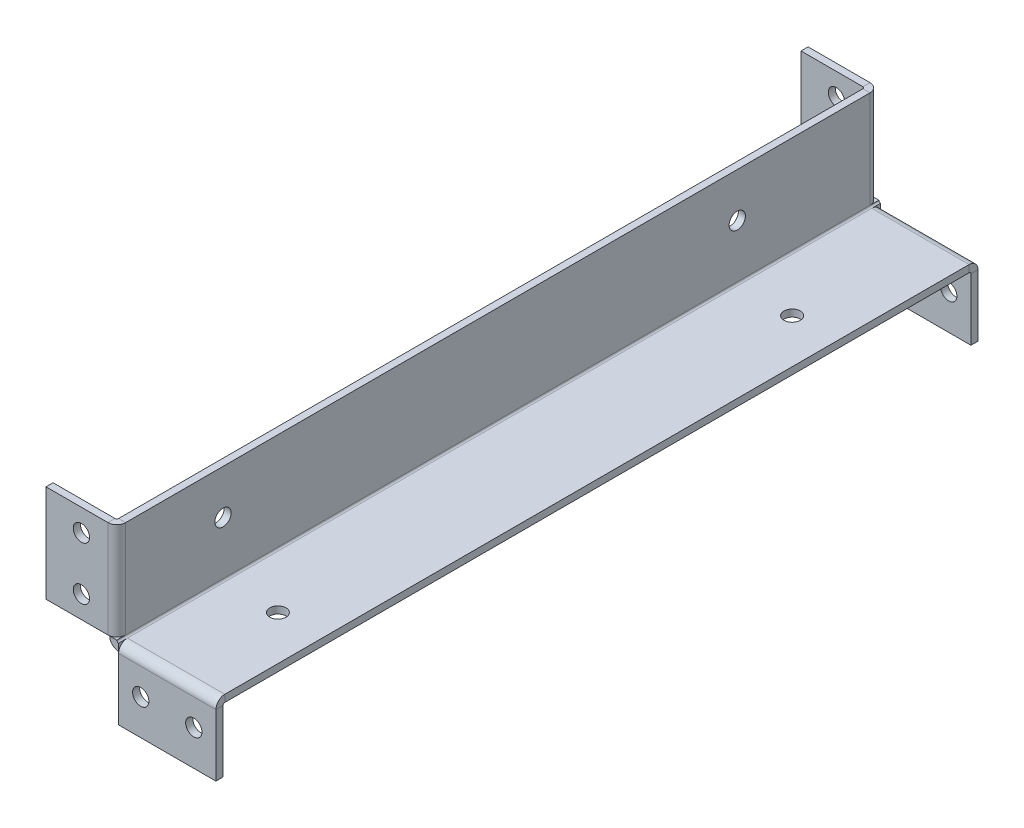
from build123d import *

# Parameters (mm, degrees)
SKETCH1_W                      = 60
SKETCH1_H                      = 430.5
BASE_FLANGE1_DEPTH             = 4
EDGE_FLANGE1_STRIP_W           = 18
EDGE_FLANGE1_STRIP_H           = 4
EDGE_FLANGE1_STRIP_CUT_DEPTH   = 430.5
EDGE_FLANGE1_DEPTH             = 430.5
EDGE_FLANGE2_STRIP_W           = 18
EDGE_FLANGE2_STRIP_H           = 4
EDGE_FLANGE2_STRIP_CUT_DEPTH   = 55
EDGE_FLANGE2_STRIP_2_W         = 18
EDGE_FLANGE2_STRIP_2_H         = 4
EDGE_FLANGE2_STRIP_CUT_2_DEPTH = 55
EDGE_FLANGE2_STRIP_3_W         = 18
EDGE_FLANGE2_STRIP_3_H         = 4
EDGE_FLANGE2_STRIP_CUT_3_DEPTH = 55
EDGE_FLANGE2_STRIP_4_W         = 18
EDGE_FLANGE2_STRIP_4_H         = 4
EDGE_FLANGE2_STRIP_CUT_4_DEPTH = 55
EDGE_FLANGE2_DEPTH             = 55
EDGE_FLANGE2_BEND_DEPTH        = 55
EDGE_FLANGE2_BEND_2_DEPTH      = 55
EDGE_FLANGE2_BEND_3_DEPTH      = 55
SKETCH18_R                     = 4.6
EXTRUDE1_DEPTH                 = 440.643321341
SKETCH19_R                     = 4.6
EXTRUDE2_DEPTH                 = 4
SKETCH20_R                     = 4.6
EXTRUDE3_DEPTH                 = 4


# Sheet-metal steps are written as plain solids
with BuildPart() as part:
    # Sketch1 → Base-Flange1 (new body)
    with BuildSketch(Plane(origin=(0, 0, 0), x_dir=(1, 0, 0), z_dir=(0, 1, 0))):
        Rectangle(SKETCH1_W, SKETCH1_H)
    extrude(amount=BASE_FLANGE1_DEPTH)

    # Edge-Flange1 strip (across the edge) → Edge-Flange1 strip cut (cut)
    with BuildSketch(Plane(origin=(-30, 4, -215.25), x_dir=(1, 0, 0), z_dir=(0, 0, 1))):
        with Locations((-4, -2)):
            Rectangle(EDGE_FLANGE1_STRIP_W, EDGE_FLANGE1_STRIP_H)
    extrude(amount=EDGE_FLANGE1_STRIP_CUT_DEPTH, mode=Mode.SUBTRACT)

    # Edge-Flange1 section (across the edge) → Edge-Flange1 (add)
    with BuildSketch(Plane(origin=(-30, 4, -215.25), x_dir=(1, 0, 0), z_dir=(0, 0, 1))):
        with BuildLine():
            Line((0, 1), (0, 56))
            Line((0, 56), (4, 56))
            Line((4, 56), (4, 1))
            ThreePointArc((4, 1), (4.292893219, 0.292893219), (5, 0))
            Line((5, 0), (5, -4))
            ThreePointArc((5, -4), (1.464466094, -2.535533906), (0, 1))
        make_face()
    extrude(amount=EDGE_FLANGE1_DEPTH)

    # Edge-Flange2 strip (across the edge) → Edge-Flange2 strip cut (cut)
    with BuildSketch(Plane(origin=(-30, 5, 215.25), x_dir=(0, 0, -1), z_dir=(0, 1, 0))):
        with Locations((-4, -2)):
            Rectangle(EDGE_FLANGE2_STRIP_W, EDGE_FLANGE2_STRIP_H)
    extrude(amount=EDGE_FLANGE2_STRIP_CUT_DEPTH, mode=Mode.SUBTRACT)

    # Edge-Flange2 strip 2 (across the edge) → Edge-Flange2 strip cut 2 (cut)
    with BuildSketch(Plane(origin=(30, 0, 215.25), x_dir=(0, 0, -1), z_dir=(-1, 0, 0))):
        with Locations((-4, -2)):
            Rectangle(EDGE_FLANGE2_STRIP_2_W, EDGE_FLANGE2_STRIP_2_H)
    extrude(amount=EDGE_FLANGE2_STRIP_CUT_2_DEPTH, mode=Mode.SUBTRACT)

    # Edge-Flange2 strip 3 (across the edge) → Edge-Flange2 strip cut 3 (cut)
    with BuildSketch(Plane(origin=(-30, 60, -215.25), x_dir=(0, 0, 1), z_dir=(0, -1, 0))):
        with Locations((-4, -2)):
            Rectangle(EDGE_FLANGE2_STRIP_3_W, EDGE_FLANGE2_STRIP_3_H)
    extrude(amount=EDGE_FLANGE2_STRIP_CUT_3_DEPTH, mode=Mode.SUBTRACT)

    # Edge-Flange2 strip 4 (across the edge) → Edge-Flange2 strip cut 4 (cut)
    with BuildSketch(Plane(origin=(-25, 0, -215.25), x_dir=(0, 0, 1), z_dir=(1, 0, 0))):
        with Locations((-4, -2)):
            Rectangle(EDGE_FLANGE2_STRIP_4_W, EDGE_FLANGE2_STRIP_4_H)
    extrude(amount=EDGE_FLANGE2_STRIP_CUT_4_DEPTH, mode=Mode.SUBTRACT)

    # Edge-Flange2 section (across the edge) → Edge-Flange2 (add)
    with BuildSketch(Plane(origin=(-30, 5, 215.25), x_dir=(0, 0, -1), z_dir=(0, 1, 0))):
        with BuildLine():
            Line((0, 1), (0, 36))
            Line((0, 36), (4, 36))
            Line((4, 36), (4, 1))
            ThreePointArc((4, 1), (4.292893219, 0.292893219), (5, 0))
            Line((5, 0), (5, -4))
            ThreePointArc((5, -4), (1.464466094, -2.535533906), (0, 1))
        make_face()
    extrude(amount=EDGE_FLANGE2_DEPTH)

    # Edge-Flange2 section 2 (across the edge) → Edge-Flange2 bend (add)
    with BuildSketch(Plane(origin=(30, 0, 215.25), x_dir=(0, 0, -1), z_dir=(-1, 0, 0))):
        with BuildLine():
            Line((0, 1), (0, 36))
            Line((0, 36), (4, 36))
            Line((4, 36), (4, 1))
            ThreePointArc((4, 1), (4.292893219, 0.292893219), (5, 0))
            Line((5, 0), (5, -4))
            ThreePointArc((5, -4), (1.464466094, -2.535533906), (0, 1))
        make_face()
    extrude(amount=EDGE_FLANGE2_BEND_DEPTH)

    # Edge-Flange2 section 3 (across the edge) → Edge-Flange2 bend 2 (add)
    with BuildSketch(Plane(origin=(-30, 60, -215.25), x_dir=(0, 0, 1), z_dir=(0, -1, 0))):
        with BuildLine():
            Line((0, 1), (0, 36))
            Line((0, 36), (4, 36))
            Line((4, 36), (4, 1))
            ThreePointArc((4, 1), (4.292893219, 0.292893219), (5, 0))
            Line((5, 0), (5, -4))
            ThreePointArc((5, -4), (1.464466094, -2.535533906), (0, 1))
        make_face()
    extrude(amount=EDGE_FLANGE2_BEND_2_DEPTH)

    # Edge-Flange2 section 4 (across the edge) → Edge-Flange2 bend 3 (add)
    with BuildSketch(Plane(origin=(-25, 0, -215.25), x_dir=(0, 0, 1), z_dir=(1, 0, 0))):
        with BuildLine():
            Line((0, 1), (0, 36))
            Line((0, 36), (4, 36))
            Line((4, 36), (4, 1))
            ThreePointArc((4, 1), (4.292893219, 0.292893219), (5, 0))
            Line((5, 0), (5, -4))
            ThreePointArc((5, -4), (1.464466094, -2.535533906), (0, 1))
        make_face()
    extrude(amount=EDGE_FLANGE2_BEND_3_DEPTH)

    # Sketch18 → Extrude1 (cut, through all)
    with BuildSketch(Plane.XY.offset(215.25)):
        with Locations((-46, 47.5)):
            Circle(SKETCH18_R)
        with Locations((-46, 17.5)):
            Circle(SKETCH18_R)
        with Locations((-12.5, -16)):
            Circle(SKETCH18_R)
        with Locations((17.5, -16)):
            Circle(SKETCH18_R)
    extrude(amount=-EXTRUDE1_DEPTH, mode=Mode.SUBTRACT)

    # Sketch19 → Extrude2 (cut)
    with BuildSketch(Plane(origin=(-26, 0, 0), x_dir=(0, 0, -1), z_dir=(1, 0, 0))):
        with Locations(Location((-155.25, 35, 0), (0, 0, 90))):
            Circle(SKETCH19_R)
        with Locations(Location((135.25, 35, 0), (0, 0, 90))):
            Circle(SKETCH19_R)
    extrude(amount=-EXTRUDE2_DEPTH, mode=Mode.SUBTRACT)

    # Sketch20 → Extrude3 (cut)
    with BuildSketch(Plane(origin=(0, 4, 0), x_dir=(1, 0, 0), z_dir=(0, 1, 0))):
        with Locations(Location((5, 135.25, 0), (0, 0, 270))):
            Circle(SKETCH20_R)
        with Locations(Location((5, -155.25, 0), (0, 0, 270))):
            Circle(SKETCH20_R)
    extrude(amount=-EXTRUDE3_DEPTH, mode=Mode.SUBTRACT)


solid = part.part
